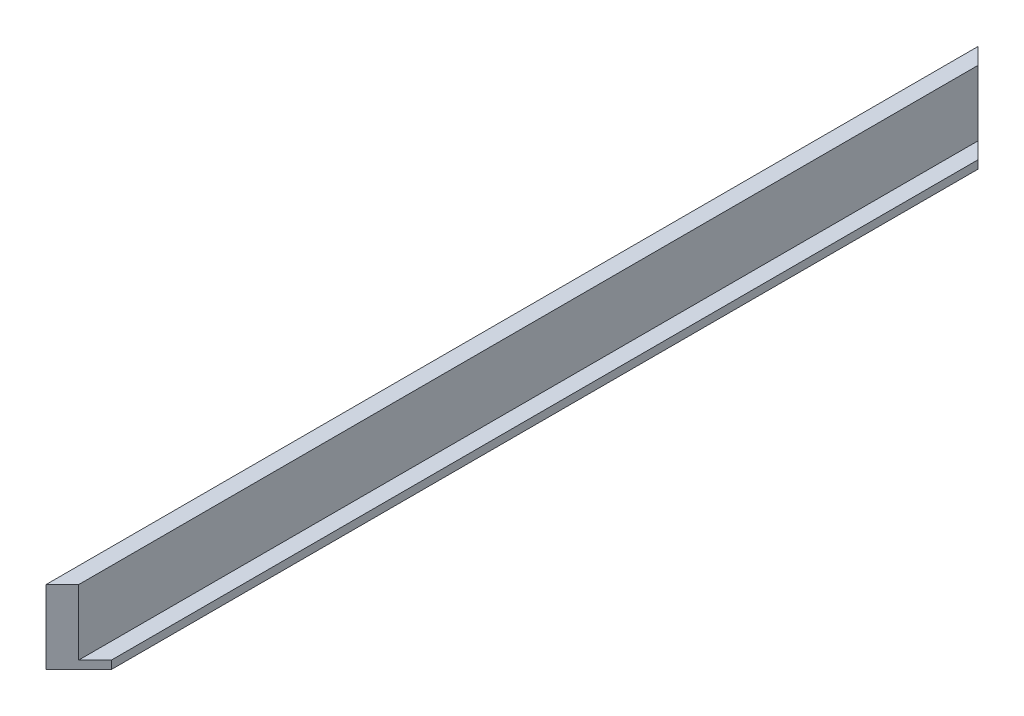
from build123d import *

# Parameters (mm, degrees)
BOSS_EXTRU_1_DEPTH      = 300
ENL_V_MAT_EXTRU_1_DEPTH = 304.521004216


with BuildPart() as part:
    # Esquisse1 → Boss.-Extru.1 (new, symmetric)
    with BuildSketch(Plane.XY):
        Polygon((-10, 40), (-10, -5), (10, -5), (10, 0), (0, 0), (0, 40), align=None)
    extrude(amount=BOSS_EXTRU_1_DEPTH, both=True)

    # Esquisse2 → Enlèv. mat.-Extru.1 (cut, symmetric)
    with BuildSketch(Plane.XZ.offset(5)):
        Polygon((10, 265), (-10, 285), (-10, 300), (10, 300), align=None)
    enl_v_mat_extru_1 = extrude(amount=ENL_V_MAT_EXTRU_1_DEPTH, both=True, mode=Mode.SUBTRACT)

    # Symétrie1: Enlèv. mat.-Extru.1 across plane
    add(enl_v_mat_extru_1.mirror(Plane.XY), mode=Mode.SUBTRACT)


solid = part.part
